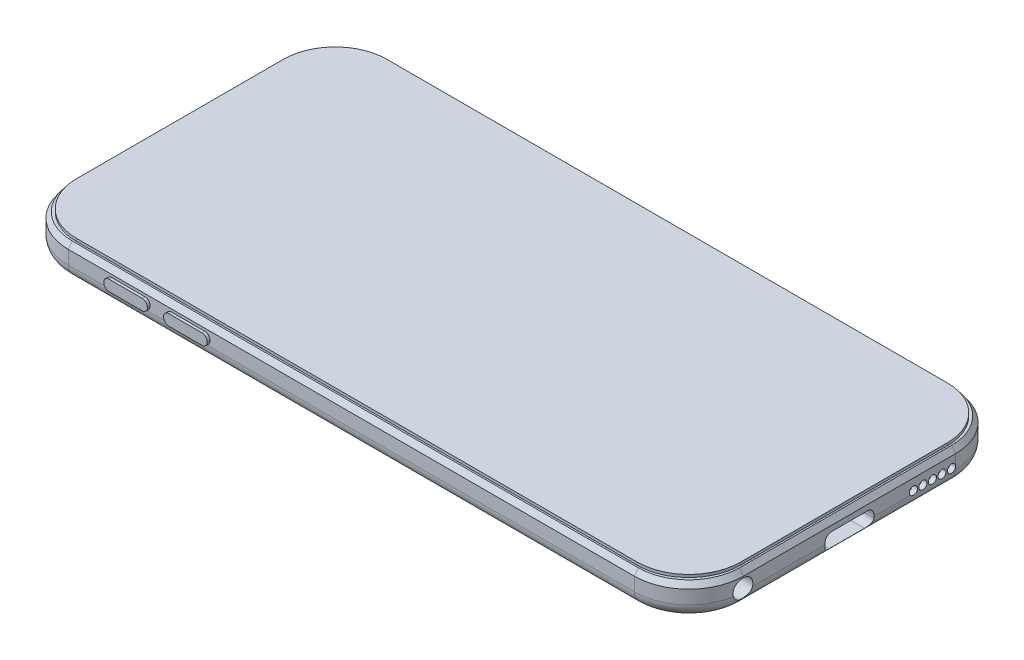
from build123d import *
from OCP.BRepFilletAPI import BRepFilletAPI_MakeChamfer

# Parameters (mm, degrees)
BODY_DEPTH                   = 6
BODY_FILLET_R                = 2.5
BODY_CHAMFER_SIZE            = 1
BODY_CHAMFER_SIZE2           = 0.700207538
SKETCH2_R                    = 0.5
FRONT_CAMERA_HOLE_DEPTH      = 0.5
FRONT_CAMERA_CHAMFER_SIZE    = 0.5
FRONT_CAMERA_CHAMFER_SIZE2   = 0.350103769
SKETCH3_W                    = 90
SKETCH3_H                    = 51
LCD_DEPTH                    = 0.1
POWER_BUTTON_DEPTH           = 0.5
GLASS_SCREEN_DEPTH           = 0.5
VOLUME_BUTTONS_DEPTH         = 0.5
SKETCH7_R                    = 5
HOME_BUTTON_HOLE_DEPTH       = 0.5
SKETCH8_R                    = 4.875
BOSS_EXTRUDE4_DEPTH          = 1
CUT_EXTRUDE4_DEPTH           = 0.001
SKETCH13_R                   = 1.75
F_3_5MM_HEADPHONE_JACK_DEPTH = 14
SKETCH15_R                   = 0.75
SPEAKER_HOLES_DEPTH          = 1
CHARGER_SOCKET_DEPTH         = 4
SKETCH18_R                   = 4
OUTER_CAMERA_RING_DEPTH      = 0.5
SKETCH19_R                   = 3.5
CAMERA_GLASS_DEPTH           = 0.5
SKETCH20_R                   = 2
INNER_CAMERA_RING_DEPTH      = 0.2
SKETCH21_R                   = 1
IRIS_DEPTH                   = 0.05
IRIS_FILLET_R                = 0.1
SKETCH22_R                   = 3.5
SKETCH22_R_2                 = 2
THICK_RING_DEPTH             = 0.1
SKETCH23_R                   = 3.5
CAMERA_BASE_DEPTH            = 0.1
RUBBER_FINGER_PLACE_DEPTH    = 0.001
SKETCH25_R                   = 4
STRAP_HOLE_DEPTH             = 1
SKETCH26_R                   = 3.95
STRAP_RING_DEPTH             = 1
SKETCH27_R                   = 2
CUT_EXTRUDE12_DEPTH          = 1.5
BOSS_EXTRUDE17_START         = 1.5
SKETCH28_R                   = 2
SKETCH28_R_2                 = 1.5
BOSS_EXTRUDE17_DEPTH         = 1.5
MIC_DEPTH                    = 0.5
MIC_CHAMFER_SIZE             = 0.075
MIC_MESH_DEPTH               = 0.05
SKETCH32_R                   = 4.859924681
HOME_BUTTON_DEPTH            = 0.49


with BuildPart() as part:
    # Sketch1 → Body (new body)
    with BuildSketch(Plane(origin=(0, 0, 0), x_dir=(1, 0, 0), z_dir=(0, 1, 0))):
        with BuildLine():
            Line((-52, 29.5), (52, 29.5))
            ThreePointArc((52, 29.5), (59.071067812, 26.571067812), (62, 19.5))
            Line((62, 19.5), (62, -19.5))
            ThreePointArc((62, -19.5), (59.071067812, -26.571067812), (52, -29.5))
            Line((52, -29.5), (-52, -29.5))
            ThreePointArc((-52, -29.5), (-59.071067812, -26.571067812), (-62, -19.5))
            Line((-62, -19.5), (-62, 19.5))
            ThreePointArc((-62, 19.5), (-59.071067812, 26.571067812), (-52, 29.5))
        make_face()
    extrude(amount=BODY_DEPTH)

    # Body Fillet
    body_fillet_edges = [part.edges().sort_by_distance(p)[0] for p in [
        (0, 0, -29.5),
        (59.071067812, 0, -26.571067812),
        (62, 0, 0),
        (59.071067812, 0, 26.571067812),
        (0, 0, 29.5),
        (-59.071067812, 0, 26.571067812),
        (-62, 0, 0),
        (-59.071067812, 0, -26.571067812),
    ]]
    fillet(body_fillet_edges, radius=BODY_FILLET_R)

    # Body Chamfer: one chamfer whose edges measure the first distance from different faces: ONE call of the kernel's chamfer builder (chamfer() names one face for all edges)
    body_chamfer_edges_1 = [part.edges().sort_by_distance(p)[0] for p in [
        (-59.071067812, 6, 26.571067812),
    ]]
    body_chamfer_side_1 = [part.faces().sort_by_distance(p)[0] for p in [
        (-59.071067812, 4.25, 26.571067812),
    ]]
    body_chamfer_edges_2 = [part.edges().sort_by_distance(p)[0] for p in [
        (0, 6, 29.5),
    ]]
    body_chamfer_side_2 = [part.faces().sort_by_distance(p)[0] for p in [
        (0, 4.25, 29.5),
    ]]
    body_chamfer_edges_3 = [part.edges().sort_by_distance(p)[0] for p in [
        (59.071067812, 6, 26.571067812),
    ]]
    body_chamfer_side_3 = [part.faces().sort_by_distance(p)[0] for p in [
        (59.071067812, 4.25, 26.571067812),
    ]]
    body_chamfer_edges_4 = [part.edges().sort_by_distance(p)[0] for p in [
        (62, 6, 0),
    ]]
    body_chamfer_side_4 = [part.faces().sort_by_distance(p)[0] for p in [
        (62, 4.25, 0),
    ]]
    body_chamfer = BRepFilletAPI_MakeChamfer(part.part.solid().wrapped)
    for e in body_chamfer_edges_1:
        body_chamfer.Add(BODY_CHAMFER_SIZE, BODY_CHAMFER_SIZE2, e.wrapped, body_chamfer_side_1[0].wrapped)  # the first distance lies on this face
    for e in body_chamfer_edges_2:
        body_chamfer.Add(BODY_CHAMFER_SIZE, BODY_CHAMFER_SIZE2, e.wrapped, body_chamfer_side_2[0].wrapped)  # the first distance lies on this face
    for e in body_chamfer_edges_3:
        body_chamfer.Add(BODY_CHAMFER_SIZE, BODY_CHAMFER_SIZE2, e.wrapped, body_chamfer_side_3[0].wrapped)  # the first distance lies on this face
    for e in body_chamfer_edges_4:
        body_chamfer.Add(BODY_CHAMFER_SIZE, BODY_CHAMFER_SIZE2, e.wrapped, body_chamfer_side_4[0].wrapped)  # the first distance lies on this face
    add(Compound.cast(body_chamfer.Shape()), mode=Mode.REPLACE)

    # Sketch2 → Front Camera Hole (cut)
    with BuildSketch(Plane(origin=(0, 6, 0), x_dir=(1, 0, 0), z_dir=(0, 1, 0))):
        with Locations(Location((-54.299792462, 0, 0), (0, 0, 270))):
            Circle(SKETCH2_R)
    extrude(amount=-FRONT_CAMERA_HOLE_DEPTH, mode=Mode.SUBTRACT)

    # Front Camera Chamfer
    front_camera_chamfer_edges = [part.edges().sort_by_distance(p)[0] for p in [
        (-54.299792462, 6, -0.5),
    ]]
    front_camera_chamfer_side = [part.faces().sort_by_distance(p)[0] for p in [
        (0.006104056, 6, 0),
    ]]
    chamfer(front_camera_chamfer_edges, length=FRONT_CAMERA_CHAMFER_SIZE, length2=FRONT_CAMERA_CHAMFER_SIZE2, reference=front_camera_chamfer_side[0])

    # Sketch3 → LCD (cut)
    with BuildSketch(Plane(origin=(0, 6, 0), x_dir=(1, 0, 0), z_dir=(0, 1, 0))):
        with Locations((-0.299792462, -0.299792462)):
            Rectangle(SKETCH3_W, SKETCH3_H)
    extrude(amount=-LCD_DEPTH, mode=Mode.SUBTRACT)

    # Sketch11 → Power Button (add, symmetric)
    with BuildSketch(Plane.ZY.offset(62)):
        with BuildLine():
            Line((-19.55, 4.5), (-12.45, 4.5))
            ThreePointArc((-12.45, 4.5), (-11.778248558, 4.221751442), (-11.5, 3.55))
            Line((-11.5, 3.55), (-11.5, 3.45))
            ThreePointArc((-11.5, 3.45), (-11.778248558, 2.778248558), (-12.45, 2.5))
            Line((-12.45, 2.5), (-19.55, 2.5))
            ThreePointArc((-19.55, 2.5), (-20.221751442, 2.778248558), (-20.5, 3.45))
            Line((-20.5, 3.45), (-20.5, 3.55))
            ThreePointArc((-20.5, 3.55), (-20.221751442, 4.221751442), (-19.55, 4.5))
        make_face()
    extrude(amount=POWER_BUTTON_DEPTH, both=True)

    # Sketch5 → Volume Buttons (add)
    with BuildSketch(Plane.XY.offset(29.5)):
        with BuildLine():
            Line((-37.95, 4.5), (-44.05, 4.5))
            ThreePointArc((-44.05, 4.5), (-44.721751442, 4.221751442), (-45, 3.55))
            Line((-45, 3.55), (-45, 3.45))
            ThreePointArc((-45, 3.45), (-44.721751442, 2.778248558), (-44.05, 2.5))
            Line((-44.05, 2.5), (-37.95, 2.5))
            ThreePointArc((-37.95, 2.5), (-37.278248558, 2.778248558), (-37, 3.45))
            Line((-37, 3.45), (-37, 3.55))
            ThreePointArc((-37, 3.55), (-37.278248558, 4.221751442), (-37.95, 4.5))
        make_face()
        with BuildLine():
            Line((-33.05, 4.5), (-26.95, 4.5))
            ThreePointArc((-26.95, 4.5), (-26.278248558, 4.221751442), (-26, 3.55))
            Line((-26, 3.55), (-26, 3.45))
            ThreePointArc((-26, 3.45), (-26.278248558, 2.778248558), (-26.95, 2.5))
            Line((-26.95, 2.5), (-33.05, 2.5))
            ThreePointArc((-33.05, 2.5), (-33.721751442, 2.778248558), (-34, 3.45))
            Line((-34, 3.45), (-34, 3.55))
            ThreePointArc((-34, 3.55), (-33.721751442, 4.221751442), (-33.05, 4.5))
        make_face()
    extrude(amount=VOLUME_BUTTONS_DEPTH)

    # Sketch7 → Home Button Hole (cut)
    with BuildSketch(Plane(origin=(0, 6, 0), x_dir=(1, 0, 0), z_dir=(0, 1, 0))):
        with Locations(Location((52.700207538, 0, 0), (0, 0, 270))):
            Circle(SKETCH7_R)
    extrude(amount=-HOME_BUTTON_HOLE_DEPTH, mode=Mode.SUBTRACT)

    # Sketch13 → 3.5mm Headphone Jack (cut)
    with BuildSketch(Plane(origin=(62, 0, 0), x_dir=(0, 0, -1), z_dir=(1, 0, 0))):
        with Locations((-19.5, 3)):
            Circle(SKETCH13_R)
    extrude(amount=-F_3_5MM_HEADPHONE_JACK_DEPTH, mode=Mode.SUBTRACT)

    # Sketch15 → Speaker Holes (cut)
    with BuildSketch(Plane(origin=(62, 0, 0), x_dir=(0, 0, -1), z_dir=(1, 0, 0))):
        with Locations((18.75, 3)):
            Circle(SKETCH15_R)
        with Locations((17, 3)):
            Circle(SKETCH15_R)
        with Locations((15.25, 3)):
            Circle(SKETCH15_R)
        with Locations((13.5, 3)):
            Circle(SKETCH15_R)
        with Locations((11.75, 3)):
            Circle(SKETCH15_R)
    extrude(amount=-SPEAKER_HOLES_DEPTH, mode=Mode.SUBTRACT)

    # Sketch16 → Charger Socket (cut)
    with BuildSketch(Plane(origin=(62, 0, 0), x_dir=(0, 0, -1), z_dir=(1, 0, 0))):
        with BuildLine():
            Line((-3.25, 4), (3.25, 4))
            ThreePointArc((3.25, 4), (4.133883476, 3.633883476), (4.5, 2.75))
            Line((4.5, 2.75), (4.5, 2.25))
            ThreePointArc((4.5, 2.25), (4.133883476, 1.366116524), (3.25, 1))
            Line((3.25, 1), (-3.25, 1))
            ThreePointArc((-3.25, 1), (-4.133883476, 1.366116524), (-4.5, 2.25))
            Line((-4.5, 2.25), (-4.5, 2.75))
            ThreePointArc((-4.5, 2.75), (-4.133883476, 3.633883476), (-3.25, 4))
        make_face()
    extrude(amount=-CHARGER_SOCKET_DEPTH, mode=Mode.SUBTRACT)

    # Sketch18 → Outer Camera Ring (add)
    with BuildSketch(Plane.XZ):
        with Locations(Location((-51.984190089, -21.5, 0), (0, 0, 270))):
            Circle(SKETCH18_R)
    extrude(amount=OUTER_CAMERA_RING_DEPTH)

    # Sketch19 → Camera Glass (cut)
    with BuildSketch(Plane.XZ.offset(0.5)):
        with Locations(Location((-51.984190089, -21.5, 0), (0, 0, 270))):
            Circle(SKETCH19_R)
    extrude(amount=-CAMERA_GLASS_DEPTH, mode=Mode.SUBTRACT)

    # Sketch20 → Inner Camera Ring (add)
    with BuildSketch(Plane.XZ):
        with Locations(Location((-51.984190089, -21.5, 0), (0, 0, 270))):
            Circle(SKETCH20_R)
    extrude(amount=INNER_CAMERA_RING_DEPTH)

    # Sketch21 → Iris (cut)
    with BuildSketch(Plane.XZ.offset(0.2)):
        with Locations(Location((-51.984190089, -21.5, 0), (0, 0, 270))):
            Circle(SKETCH21_R)
    extrude(amount=-IRIS_DEPTH, mode=Mode.SUBTRACT)

    # Iris fillet
    # the kernel refuses this fillet: 0.1 mm, written as the material it takes off along each edge
    with BuildSketch(Plane(origin=(-51.984190089, -0.2, -21.5), x_dir=(0, 0, -1), z_dir=(-1, 0, 0))) as iris_fillet_piece_1:
        with BuildLine():
            CenterArc((1.08660254, -0.1), IRIS_FILLET_R, 90, 60)
            Line((1, -0.05), (0.998267949, -0.049))
            ThreePointArc((0.998267949, -0.049), (0.998, -0.025), (0.998, 0))
            Line((0.998, 0), (1, 0.002))
            Line((1, 0.002), (1.08660254, 0.002))
            Line((1.08660254, 0.002), (1.08660254, 0))
        make_face()
    revolve(axis=Axis((-51.984190089, -0.2, -21.5), (0, -1, 0)), mode=Mode.SUBTRACT)

    # Sketch23 → Camera Base (add)
    with BuildSketch(Plane(origin=(0, -0.45, 0), x_dir=(-1, 0, 0), z_dir=(0, -1, 0))):
        with Locations(Location((51.984190089, 21.5, 0), (0, 0, 90))):
            Circle(SKETCH23_R)
    extrude(amount=-CAMERA_BASE_DEPTH)

    # Sketch24 → Rubber Finger Place (cut)
    with BuildSketch(Plane.XZ):
        with BuildLine():
            Line((-52.234190089, 23.416899802), (-51.734190089, 23.416899802))
            ThreePointArc((-51.734190089, 23.416899802), (-49.436093051, 22.46499684), (-48.484190089, 20.166899802))
            Line((-48.484190089, 20.166899802), (-48.484190089, 5.666899802))
            ThreePointArc((-48.484190089, 5.666899802), (-49.436093051, 3.368802763), (-51.734190089, 2.416899802))
            Line((-51.734190089, 2.416899802), (-52.234190089, 2.416899802))
            ThreePointArc((-52.234190089, 2.416899802), (-54.532287128, 3.368802763), (-55.484190089, 5.666899802))
            Line((-55.484190089, 5.666899802), (-55.484190089, 20.166899802))
            ThreePointArc((-55.484190089, 20.166899802), (-54.532287128, 22.46499684), (-52.234190089, 23.416899802))
        make_face()
    extrude(amount=-RUBBER_FINGER_PLACE_DEPTH, mode=Mode.SUBTRACT)

    # Sketch25 → Strap Hole (cut)
    with BuildSketch(Plane.XZ):
        with Locations(Location((53.5, -21.5, 0), (0, 0, 270))):
            Circle(SKETCH25_R)
    extrude(amount=-STRAP_HOLE_DEPTH, mode=Mode.SUBTRACT)

    # Sketch26 → Strap Ring (add)
    with BuildSketch(Plane.XZ.offset(-1)):
        with Locations(Location((53.5, -21.5, 0), (0, 0, 270))):
            Circle(SKETCH26_R)
    extrude(amount=STRAP_RING_DEPTH)

    # Sketch27 → Cut-Extrude12 (cut)
    with BuildSketch(Plane.XZ):
        with Locations(Location((-51.984190089, -12.450439184, 0), (0, 0, 270))):
            Circle(SKETCH27_R)
    extrude(amount=-CUT_EXTRUDE12_DEPTH, mode=Mode.SUBTRACT)

    # Sketch28 → Boss-Extrude17 (add)
    with BuildSketch(Plane.XZ.offset(-1.5).offset(BOSS_EXTRUDE17_START)):
        with Locations((-51.984190089, -12.450439184)):
            Circle(SKETCH28_R)
        with Locations(Location((-51.984190089, -12.450439184, 0), (0, 0, 270))):
            Circle(SKETCH28_R_2, mode=Mode.SUBTRACT)
    extrude(amount=-BOSS_EXTRUDE17_DEPTH)

    # Sketch29 → Mic (cut)
    with BuildSketch(Plane.XZ):
        with BuildLine():
            Line((-51.75953323, -15.040044339), (-51.75953323, -15.55093494))
            ThreePointArc((-51.75953323, -15.55093494), (-51.984190089, -15.775591799), (-52.208846949, -15.55093494))
            Line((-52.208846949, -15.55093494), (-52.208846949, -15.040044339))
            ThreePointArc((-52.208846949, -15.040044339), (-51.984190089, -14.815387479), (-51.75953323, -15.040044339))
        make_face()
    extrude(amount=-MIC_DEPTH, mode=Mode.SUBTRACT)

    # Mic Chamfer
    mic_chamfer_edges = [part.edges().sort_by_distance(p)[0] for p in [
        (-51.984190089, 0, -14.815387479),
        (-52.208846949, 0, -15.295489639),
        (-51.984190089, 0, -15.775591799),
        (-51.75953323, 0, -15.295489639),
    ]]
    chamfer(mic_chamfer_edges, length=MIC_CHAMFER_SIZE)

    # Sketch32 → Home Button (add)
    with BuildSketch(Plane(origin=(0, 5.5, 0), x_dir=(1, 0, 0), z_dir=(0, 1, 0))):
        with Locations(Location((52.700207538, 0, 0), (0, 0, 270))):
            Circle(SKETCH32_R)
    extrude(amount=HOME_BUTTON_DEPTH)


with BuildPart() as body_2:
    # Sketch4 → Glass Screen (new body)
    with BuildSketch(Plane(origin=(0, 6, 0), x_dir=(1, 0, 0), z_dir=(0, 1, 0))):
        with BuildLine():
            Line((51.5, -28.5), (-51.5, -28.5))
            ThreePointArc((-51.5, -28.5), (-58.217514421, -25.717514421), (-61, -19))
            Line((-61, -19), (-61, 19))
            ThreePointArc((-61, 19), (-58.217514421, 25.717514421), (-51.5, 28.5))
            Line((-51.5, 28.5), (51.5, 28.5))
            ThreePointArc((51.5, 28.5), (58.217514421, 25.717514421), (61, 19))
            Line((61, 19), (61, -19))
            ThreePointArc((61, -19), (58.217514421, -25.717514421), (51.5, -28.5))
        make_face()
    extrude(amount=GLASS_SCREEN_DEPTH)


with BuildPart() as body_3:
    # Sketch8 → Boss-Extrude4 (new body)
    with BuildSketch(Plane(origin=(0, 5.5, 0), x_dir=(1, 0, 0), z_dir=(0, 1, 0))):
        with Locations(Location((52.700207538, 0, 0), (0, 0, 270))):
            Circle(SKETCH8_R)
    extrude(amount=BOSS_EXTRUDE4_DEPTH)

    # Sketch10 → Cut-Extrude4 (cut)
    with BuildSketch(Plane(origin=(0, 6.5, 0), x_dir=(1, 0, 0), z_dir=(0, 1, 0))):
        with BuildLine():
            Line((51.450207538, 2), (53.950207538, 2))
            ThreePointArc((53.950207538, 2), (54.480537624, 1.780330086), (54.700207538, 1.25))
            Line((54.700207538, 1.25), (54.700207538, -1.25))
            ThreePointArc((54.700207538, -1.25), (54.480537624, -1.780330086), (53.950207538, -2))
            Line((53.950207538, -2), (51.450207538, -2))
            ThreePointArc((51.450207538, -2), (50.919877452, -1.780330086), (50.700207538, -1.25))
            Line((50.700207538, -1.25), (50.700207538, 1.25))
            ThreePointArc((50.700207538, 1.25), (50.919877452, 1.780330086), (51.450207538, 2))
        make_face()
        with BuildLine():
            Line((50.950207538, 1.25), (50.950207538, -1.25))
            ThreePointArc((50.950207538, -1.25), (51.096654148, -1.603553391), (51.450207538, -1.75))
            Line((51.450207538, -1.75), (53.950207538, -1.75))
            ThreePointArc((53.950207538, -1.75), (54.303760929, -1.603553391), (54.450207538, -1.25))
            Line((54.450207538, -1.25), (54.450207538, 1.25))
            ThreePointArc((54.450207538, 1.25), (54.303760929, 1.603553391), (53.950207538, 1.75))
            Line((53.950207538, 1.75), (51.450207538, 1.75))
            ThreePointArc((51.450207538, 1.75), (51.096654148, 1.603553391), (50.950207538, 1.25))
        make_face(mode=Mode.SUBTRACT)
    extrude(amount=-CUT_EXTRUDE4_DEPTH, mode=Mode.SUBTRACT)


with BuildPart() as body_4:
    # Sketch22 → Thick Ring (new body)
    with BuildSketch(Plane.XZ.offset(0.2)):
        with Locations(Location((-51.984190089, -21.5, 0), (0, 0, 270))):
            Circle(SKETCH22_R)
        with Locations(Location((-51.984190089, -21.5, 0), (0, 0, 270))):
            Circle(SKETCH22_R_2, mode=Mode.SUBTRACT)
    extrude(amount=THICK_RING_DEPTH)


with BuildPart() as body_5:
    # Sketch30 → Mic Mesh (new body)
    with BuildSketch(Plane(origin=(0, 0.075, 0), x_dir=(-1, 0, 0), z_dir=(0, -1, 0))):
        with BuildLine():
            Line((52.208067976, 15.55093494), (52.208067976, 15.040044339))
            ThreePointArc((52.208067976, 15.040044339), (51.984190089, 14.816166451), (51.760312202, 15.040044339))
            Line((51.760312202, 15.040044339), (51.760312202, 15.55093494))
            ThreePointArc((51.760312202, 15.55093494), (51.984190089, 15.774812827), (52.208067976, 15.55093494))
        make_face()
    extrude(amount=-MIC_MESH_DEPTH)


solid = Compound([part.part, body_2.part, body_3.part, body_4.part, body_5.part])
